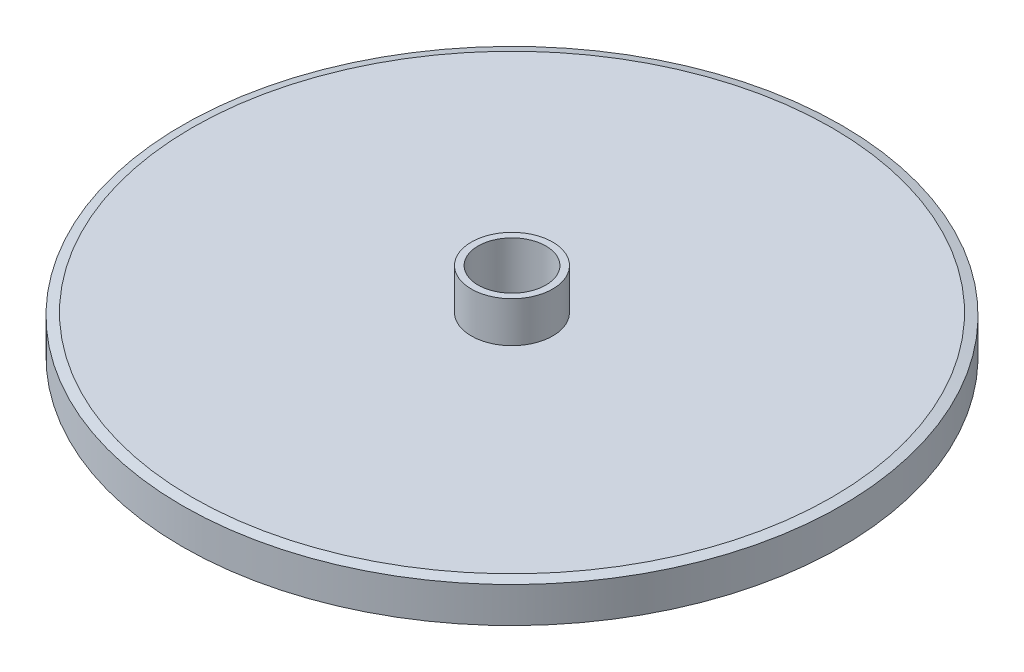
from build123d import *

# Parameters (mm, degrees)
CHAMFER_1_SIZE           = 0.705
CHAMFER_1_SIZE2          = 0.188904181
CUT_EXTRUDE_3_DEPTH      = 35.885240432
CUT_EXTRUDE_3_DEPTH_BACK = 35.885240432
SKETCH_2_R               = 2.5
CHAMFER_2_SIZE           = 0.705
CHAMFER_2_SIZE2          = 0.188904181


with BuildPart() as part:
    # Эскиз1 → Повернуть2 (revolve)
    with BuildSketch(Plane.XY):
        Polygon((0, 0), (24.3, 0), (24.3, 3), (3, 3), (3, 6), (0, 6), align=None)
    revolve(axis=Axis((0, 6, 0), (0, -1, 0)))

    # Фаска1
    chamfer_1_edges = [part.edges().sort_by_distance(p)[0] for p in [
        (-24.3, 3, 0),
    ]]
    chamfer_1_side = [part.faces().sort_by_distance(p)[0] for p in [
        (-23.612692209, 3, 0),
    ]]
    chamfer(chamfer_1_edges, length=CHAMFER_1_SIZE, length2=CHAMFER_1_SIZE2, reference=chamfer_1_side[0])

    # Эскиз2 → Вырез-Вытянуть3 (cut, two sides: drawn at the far end of the back side and taken through both)
    with BuildSketch(Plane(origin=(0, 0, 0), x_dir=(-1, 0, 0), z_dir=(0, -1, 0)).offset(-CUT_EXTRUDE_3_DEPTH_BACK)):
        Circle(SKETCH_2_R)
    extrude(amount=CUT_EXTRUDE_3_DEPTH + CUT_EXTRUDE_3_DEPTH_BACK, mode=Mode.SUBTRACT)

    # Фаска2
    chamfer_2_edges = [part.edges().sort_by_distance(p)[0] for p in [
        (-24.3, 0, 0),
    ]]
    chamfer_2_side = [part.faces().sort_by_distance(p)[0] for p in [
        (-23.612692209, 0, 0),
    ]]
    chamfer(chamfer_2_edges, length=CHAMFER_2_SIZE, length2=CHAMFER_2_SIZE2, reference=chamfer_2_side[0])


solid = part.part
